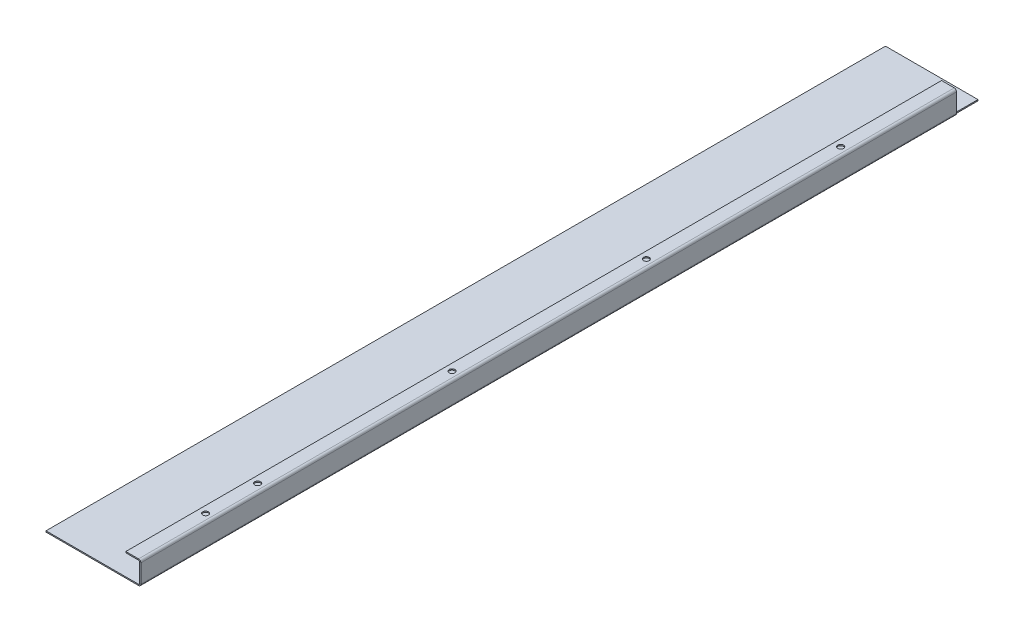
from build123d import *

# Parameters (mm, degrees)
SKETCH1_W                    = 82
SKETCH1_H                    = 725.7
BASE_FLANGE1_DEPTH           = 1
EDGE_FLANGE1_STRIP_W         = 6
EDGE_FLANGE1_STRIP_H         = 1
EDGE_FLANGE1_STRIP_CUT_DEPTH = 725.7
EDGE_FLANGE1_DEPTH           = 725.7
EDGE_FLANGE2_STRIP_W         = 6
EDGE_FLANGE2_STRIP_H         = 1
EDGE_FLANGE2_STRIP_CUT_DEPTH = 725.7
EDGE_FLANGE2_DEPTH           = 725.7
SKETCH19_R                   = 2.5
CUT_EXTRUDE2_DEPTH           = 10
CUT_EXTRUDE3_START           = -725.7
CUT_EXTRUDE3_DEPTH           = 20.5


# Read off the part's stored shape, not the designer's step: Cut-Extrude3
# Sheet-metal steps are written as plain solids
with BuildPart() as part:
    # Sketch1 → Base-Flange1 (new body)
    with BuildSketch(Plane(origin=(0, 0, 0), x_dir=(1, 0, 0), z_dir=(0, 1, 0))):
        with Locations((41, 362.85)):
            Rectangle(SKETCH1_W, SKETCH1_H)
    extrude(amount=-BASE_FLANGE1_DEPTH)

    # Edge-Flange1 strip (across the edge) → Edge-Flange1 strip cut (cut)
    with BuildSketch(Plane(origin=(82, 0, 0), x_dir=(-1, 0, 0), z_dir=(0, 0, -1))):
        with Locations((-1, -0.5)):
            Rectangle(EDGE_FLANGE1_STRIP_W, EDGE_FLANGE1_STRIP_H)
    extrude(amount=EDGE_FLANGE1_STRIP_CUT_DEPTH, mode=Mode.SUBTRACT)

    # Edge-Flange1 section (across the edge) → Edge-Flange1 (add)
    with BuildSketch(Plane(origin=(82, 0, 0), x_dir=(-1, 0, 0), z_dir=(0, 0, -1))):
        with BuildLine():
            Line((0, 1), (0, 19))
            Line((0, 19), (1, 19))
            Line((1, 19), (1, 1))
            ThreePointArc((1, 1), (1.292893219, 0.292893219), (2, 0))
            Line((2, 0), (2, -1))
            ThreePointArc((2, -1), (0.585786438, -0.414213562), (0, 1))
        make_face()
    extrude(amount=EDGE_FLANGE1_DEPTH)

    # Edge-Flange2 strip (across the edge) → Edge-Flange2 strip cut (cut)
    with BuildSketch(Plane(origin=(81, 19, 0), x_dir=(0, -1, 0), z_dir=(0, 0, -1))):
        with Locations((-1, -0.5)):
            Rectangle(EDGE_FLANGE2_STRIP_W, EDGE_FLANGE2_STRIP_H)
    extrude(amount=EDGE_FLANGE2_STRIP_CUT_DEPTH, mode=Mode.SUBTRACT)

    # Edge-Flange2 section (across the edge) → Edge-Flange2 (add)
    with BuildSketch(Plane(origin=(81, 19, 0), x_dir=(0, -1, 0), z_dir=(0, 0, -1))):
        with BuildLine():
            Line((0, 1), (0, 12))
            Line((0, 12), (1, 12))
            Line((1, 12), (1, 1))
            ThreePointArc((1, 1), (1.292893219, 0.292893219), (2, 0))
            Line((2, 0), (2, -1))
            ThreePointArc((2, -1), (0.585786438, -0.414213562), (0, 1))
        make_face()
    extrude(amount=EDGE_FLANGE2_DEPTH)

    # Sketch19 → Cut-Extrude2 (cut)
    with BuildSketch(Plane(origin=(0, 19, 0), x_dir=(1, 0, 0), z_dir=(0, 1, 0))):
        with Locations(Location((75, 63, 0), (0, 0, 180))):
            Circle(SKETCH19_R)
        with Locations(Location((75, 108, 0), (0, 0, 180))):
            Circle(SKETCH19_R)
        with Locations(Location((75, 276, 0), (0, 0, 180))):
            Circle(SKETCH19_R)
        with Locations(Location((75, 444, 0), (0, 0, 180))):
            Circle(SKETCH19_R)
        with Locations(Location((75, 612, 0), (0, 0, 180))):
            Circle(SKETCH19_R)
        with Locations((75, 780)):
            Circle(SKETCH19_R)
    extrude(amount=-CUT_EXTRUDE2_DEPTH, mode=Mode.SUBTRACT)

    # Cut-Extrude3 outline → Cut-Extrude3 (cut)
    with BuildSketch(Plane.XY.offset(CUT_EXTRUDE3_START)):
        with BuildLine():
            ThreePointArc((81, 1), (80.707106781, 0.292893219), (80, 0))
            Line((80, 0), (80, -1))
            ThreePointArc((80, -1), (81.414213562, -0.414213562), (82, 1))
            Line((82, 1), (82, 17))
            ThreePointArc((82, 17), (81.414213562, 18.414213562), (80, 19))
            Line((80, 19), (69, 19))
            Line((69, 19), (69, 18))
            Line((69, 18), (80, 18))
            ThreePointArc((80, 18), (80.707106781, 17.707106781), (81, 17))
            Line((81, 17), (81, 1))
        make_face()
    extrude(amount=CUT_EXTRUDE3_DEPTH, mode=Mode.SUBTRACT)


solid = part.part
